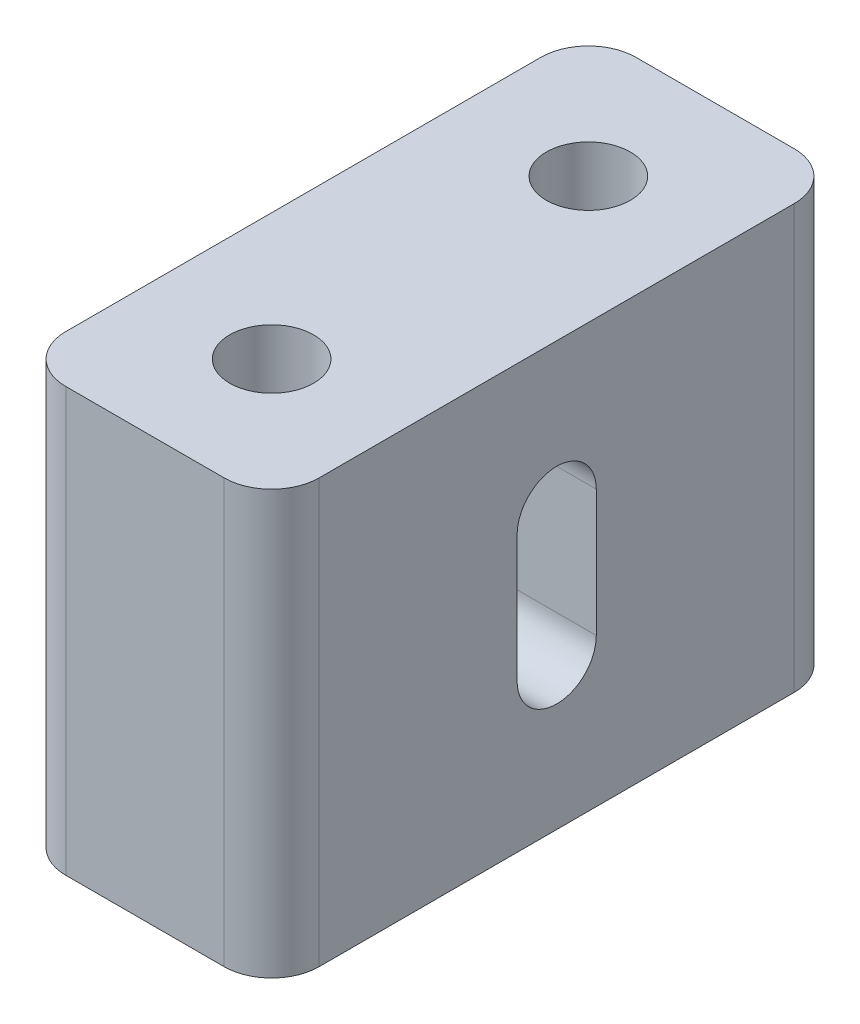
from build123d import *

# Parameters (mm, degrees)
SKETCH1_W               = 16
SKETCH1_H               = 36
BOSS_EXTRUDE1_DEPTH     = 13.366197724
M5_CLEARANCE_HOLE1_D    = 5.3
FILLET1_R               = 3
CUT_EXTRUDE1_DEPTH      = 24.804521453
CUT_EXTRUDE1_DEPTH_BACK = 24.804521453


with BuildPart() as part:
    # Sketch1 → Boss-Extrude1 (new, symmetric)
    with BuildSketch(Plane(origin=(0, 0, 0), x_dir=(1, 0, 0), z_dir=(0, 1, 0))):
        Rectangle(SKETCH1_W, SKETCH1_H)
    extrude(amount=BOSS_EXTRUDE1_DEPTH, both=True)

    # M5 Clearance Hole1 (through all)
    with Locations(Plane(origin=(0, 13.366197724, 0), x_dir=(1, 0, 0), z_dir=(0, 1, 0))):
        with Locations((0, 10), (0, -10)):
            Hole(M5_CLEARANCE_HOLE1_D / 2)

    # Fillet1
    fillet1_edges = [part.edges().sort_by_distance(p)[0] for p in [
        (-8, 0, -18),
        (8, 0, -18),
        (-8, 0, 18),
        (8, 0, 18),
    ]]
    fillet(fillet1_edges, radius=FILLET1_R)

    # Sketch6 → Cut-Extrude1 (cut, two sides: drawn at the far end of the back side and taken through both)
    with BuildSketch(Plane(origin=(0, 0, 0), x_dir=(0, 0, -1), z_dir=(1, 0, 0)).offset(-CUT_EXTRUDE1_DEPTH_BACK)):
        with BuildLine():
            Line((-2.5, -4), (-2.5, 4))
            ThreePointArc((-2.5, 4), (0, 6.5), (2.5, 4))
            Line((2.5, 4), (2.5, -4))
            ThreePointArc((2.5, -4), (0, -6.5), (-2.5, -4))
        make_face()
    extrude(amount=CUT_EXTRUDE1_DEPTH + CUT_EXTRUDE1_DEPTH_BACK, mode=Mode.SUBTRACT)


solid = part.part
